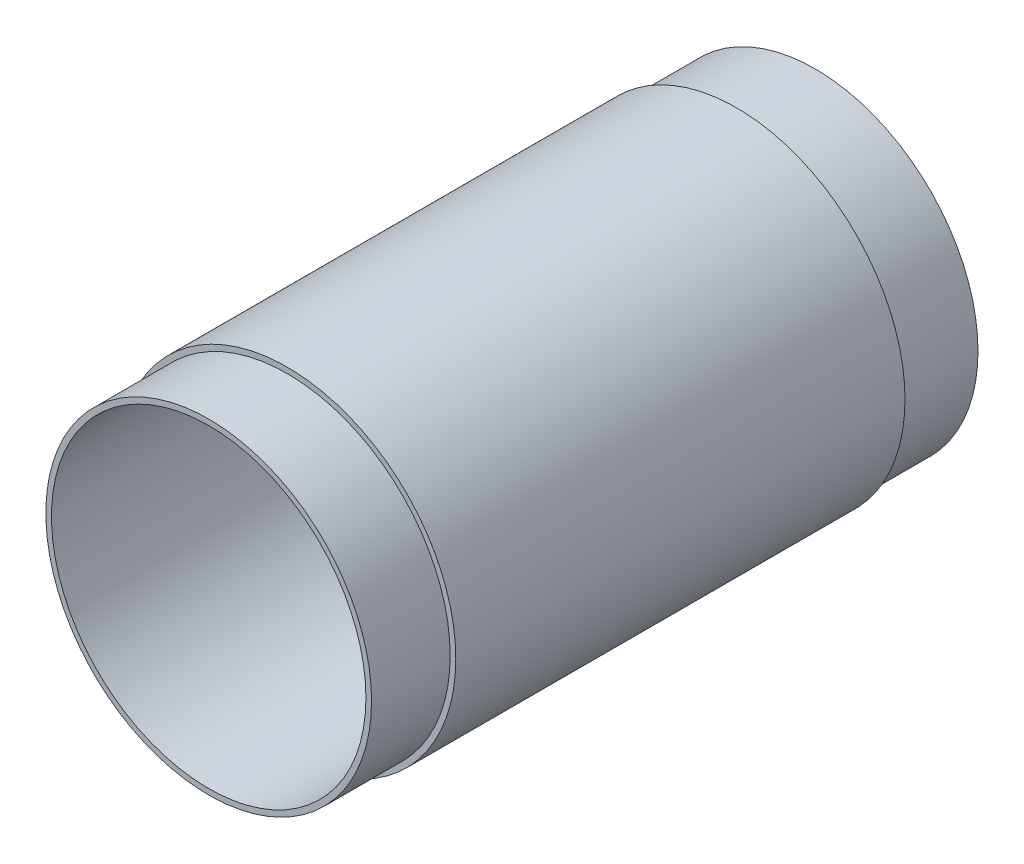
from build123d import *


with BuildPart() as part:
    # Sketch1 → Revolve1 (revolve)
    with BuildSketch(Plane(origin=(0, 0, 0), x_dir=(0, 0, -1), z_dir=(1, 0, 0))):
        Polygon((0, 14), (54, 14), (54, 14.5), (47, 14.5), (47, 15), (7, 15), (7, 14.5), (0, 14.5), align=None)
    revolve(axis=Axis((0, 0, 0), (0, 0, -1)))


solid = part.part
